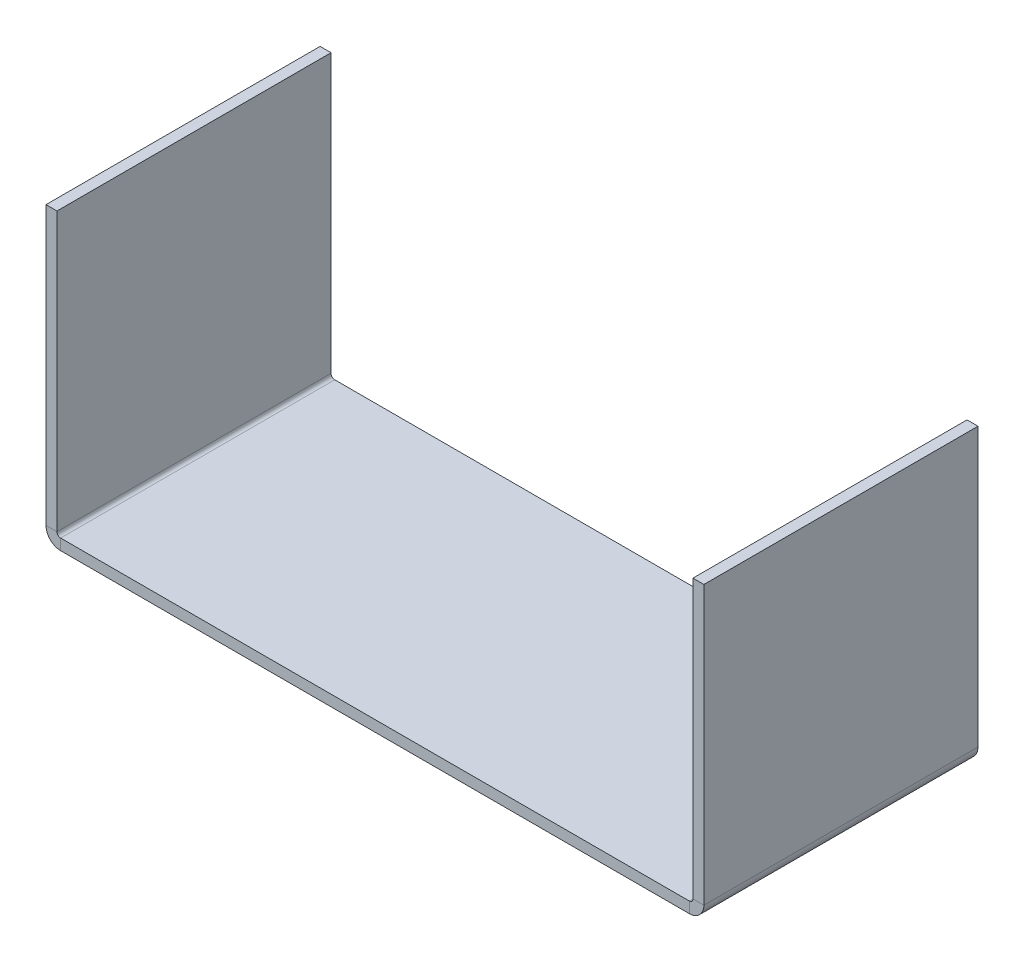
from build123d import *

# Parameters (mm, degrees)
SM_BASE_FLANGE_1_DEPTH = 75


# Sheet-metal steps are written as plain solids
with BuildPart() as part:
    # Sketch 1 → Базовая кромка1 (new body)
    with BuildSketch(Plane.XY):
        with BuildLine():
            Line((90, 80), (90, 4))
            ThreePointArc((90, 4), (88.828427125, 1.171572875), (86, 0))
            Line((86, 0), (-86, 0))
            ThreePointArc((-86, 0), (-88.828427125, 1.171572875), (-90, 4))
            Line((-90, 4), (-90, 80))
            Line((-90, 80), (-87, 80))
            Line((-87, 80), (-87, 4))
            ThreePointArc((-87, 4), (-86.707106781, 3.292893219), (-86, 3))
            Line((-86, 3), (86, 3))
            ThreePointArc((86, 3), (86.707106781, 3.292893219), (87, 4))
            Line((87, 4), (87, 80))
            Line((87, 80), (90, 80))
        make_face()
    extrude(amount=SM_BASE_FLANGE_1_DEPTH)


solid = part.part
